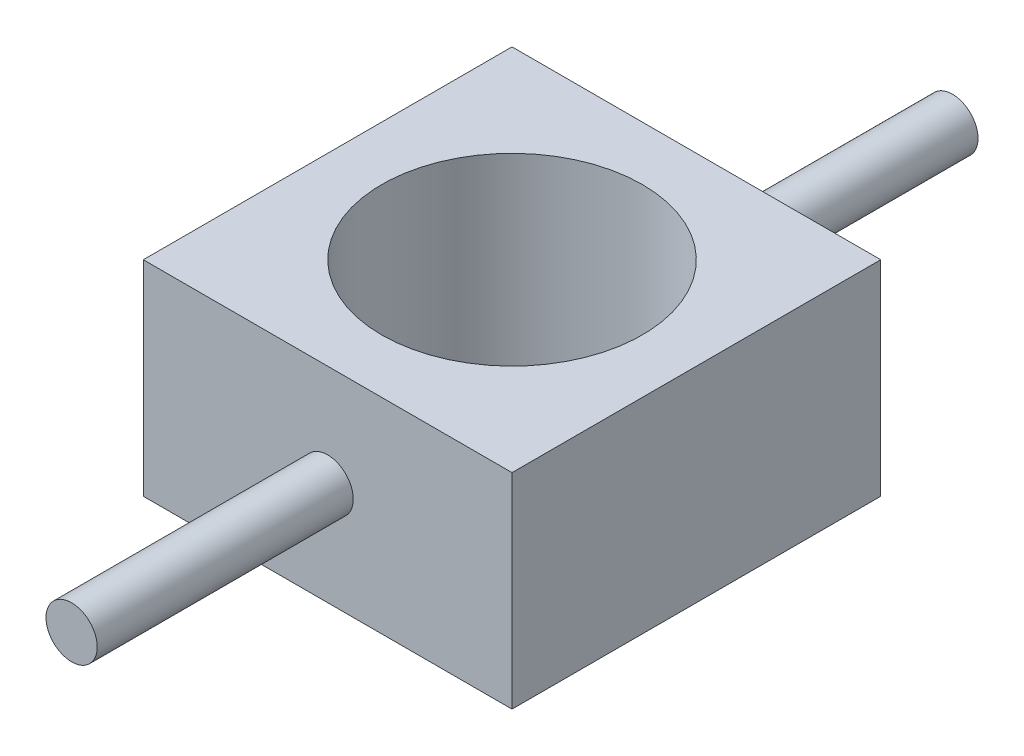
from build123d import *

# Parameters (mm, degrees)
BOSS_EXTRUDE1_DEPTH      = 10
BOSS_EXTRUDE1_DEPTH_BACK = 10
SKETCH1_W                = 36
SKETCH1_H                = 36
SKETCH2_R                = 12.725
CUT_EXTRUDE1_DEPTH       = 33.372828112
SKETCH5_R                = 2.5
BOSS_EXTRUDE2_DEPTH      = 25


with BuildPart() as part:
    # Sketch1 → Boss-Extrude1 (new, two sides: drawn at the far end of the back side and taken through both)
    with BuildSketch(Plane(origin=(0, 0, 0), x_dir=(1, 0, 0), z_dir=(0, 1, 0)).offset(-BOSS_EXTRUDE1_DEPTH_BACK)):
        Rectangle(SKETCH1_W, SKETCH1_H)
    extrude(amount=BOSS_EXTRUDE1_DEPTH + BOSS_EXTRUDE1_DEPTH_BACK)

    # Sketch2 → Cut-Extrude1 (cut, through all)
    with BuildSketch(Plane.XZ.offset(10)):
        Circle(SKETCH2_R)
    extrude(amount=-CUT_EXTRUDE1_DEPTH, mode=Mode.SUBTRACT)

    # Sketch5 → Boss-Extrude2 (add)
    with BuildSketch(Plane(origin=(0, 0, -18), x_dir=(-1, 0, 0), z_dir=(0, 0, -1))):
        Circle(SKETCH5_R)
    boss_extrude2 = extrude(amount=BOSS_EXTRUDE2_DEPTH)

    # Mirror1: Boss-Extrude2 across plane
    add(boss_extrude2.mirror(Plane.XY))


solid = part.part
